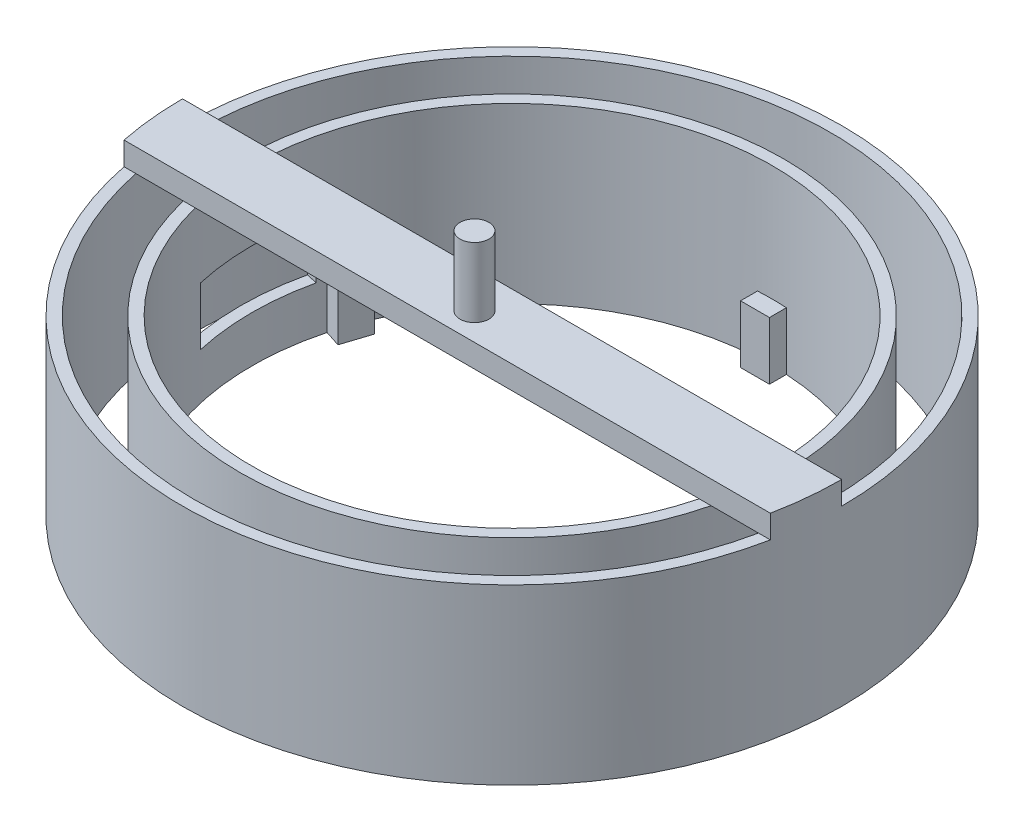
from build123d import *

# Parameters (mm, degrees)
SKETCH1_R             = 23.5
SKETCH1_R_2           = 22.5
BOSS_EXTRUDE1_DEPTH   = 15
SKETCH1_R_3           = 28.5
SKETCH1_R_4           = 27.5
BOSS_EXTRUDE1_2_DEPTH = 15
CUT_EXTRUDE2_DEPTH    = 5
BOSS_EXTRUDE3_DEPTH   = 2
SKETCH5_R             = 1.25
BOSS_EXTRUDE4_DEPTH   = 6
CUT_EXTRUDE3_START    = -2
CUT_EXTRUDE3_DEPTH    = 2
SKETCH7_W             = 2.5
SKETCH7_H             = 1.5
BOSS_EXTRUDE5_DEPTH   = 5
CIRPATTERN1_COUNT     = 5


with BuildPart() as part:
    # Sketch1 → Boss-Extrude1 (new body)
    with BuildSketch(Plane(origin=(0, 0, 0), x_dir=(1, 0, 0), z_dir=(0, 1, 0))):
        Circle(SKETCH1_R)
        Circle(SKETCH1_R_2, mode=Mode.SUBTRACT)
    extrude(amount=BOSS_EXTRUDE1_DEPTH)

    # Sketch4 → Cut-Extrude2 (cut)
    with BuildSketch(Plane(origin=(0, 4, 0), x_dir=(-1, 0, 0), z_dir=(0, -1, 0))):
        with BuildLine():
            Line((22.912407012, 5.222222222), (21.937410968, 5))
            ThreePointArc((21.937410968, 5), (22.5, 0), (21.937410968, -5))
            Line((21.937410968, -5), (22.912407012, -5.222222222))
            ThreePointArc((22.912407012, -5.222222222), (23.5, 0), (22.912407012, 5.222222222))
        make_face()
        with BuildLine():
            Line((-22.912407012, -5.222222222), (-21.937410968, -5))
            ThreePointArc((-21.937410968, -5), (-22.5, 0), (-21.937410968, 5))
            Line((-21.937410968, 5), (-22.912407012, 5.222222222))
            ThreePointArc((-22.912407012, 5.222222222), (-23.5, 0), (-22.912407012, -5.222222222))
        make_face()
        with BuildLine():
            Line((-5.222222222, -22.912407012), (-5, -21.937410968))
            ThreePointArc((-5, -21.937410968), (0, -22.5), (5, -21.937410968))
            Line((5, -21.937410968), (5.222222222, -22.912407012))
            ThreePointArc((5.222222222, -22.912407012), (0, -23.5), (-5.222222222, -22.912407012))
        make_face()
    extrude(amount=-CUT_EXTRUDE2_DEPTH, mode=Mode.SUBTRACT)



with BuildPart() as body_2:
    # Sketch1 → Boss-Extrude1 2 (new body)
    with BuildSketch(Plane(origin=(0, 0, 0), x_dir=(1, 0, 0), z_dir=(0, 1, 0))):
        Circle(SKETCH1_R_3)
        Circle(SKETCH1_R_4, mode=Mode.SUBTRACT)
    extrude(amount=BOSS_EXTRUDE1_2_DEPTH)


with BuildPart() as part_1:
    add(part.part)

    add(body_2.part)  # Boss-Extrude3 merges body 2
    # Sketch3 → Boss-Extrude3 (add)
    with BuildSketch(Plane(origin=(0, 15, 0), x_dir=(1, 0, 0), z_dir=(0, 1, 0))):
        with BuildLine():
            Line((-28.5, 0), (28.5, 0))
            ThreePointArc((28.5, 0), (0, -28.5), (-28.5, 0))
        make_face()
    extrude(amount=BOSS_EXTRUDE3_DEPTH)

    # Sketch5 → Boss-Extrude4 (add)
    with BuildSketch(Plane(origin=(0, 17, 0), x_dir=(1, 0, 0), z_dir=(0, 1, 0))):
        with Locations((0, -3.253176926)):
            Circle(SKETCH5_R)
    extrude(amount=BOSS_EXTRUDE4_DEPTH)

    # Sketch6 → Cut-Extrude3 (cut)
    with BuildSketch(Plane(origin=(0, 17, 0), x_dir=(1, 0, 0), z_dir=(0, 1, 0)).offset(CUT_EXTRUDE3_START)):
        with BuildLine():
            Line((-27.941794444, -5.613031555), (27.941794444, -5.613031555))
            ThreePointArc((27.941794444, -5.613031555), (0, -28.5), (-27.941794444, -5.613031555))
        make_face()
    extrude(amount=CUT_EXTRUDE3_DEPTH, mode=Mode.SUBTRACT)

    # Sketch7 → Boss-Extrude5 (add)
    with BuildSketch(Plane.XZ):
        with Locations((0, -21.75)):
            Rectangle(SKETCH7_W, SKETCH7_H)
    boss_extrude5 = extrude(amount=-BOSS_EXTRUDE5_DEPTH)

    # CirPattern1: Boss-Extrude5 ×5 about axis
    cirpattern1_axis = Axis((0, 0, 0), (0, 1, 0))
    for i in range(1, CIRPATTERN1_COUNT):
        add(boss_extrude5.rotate(cirpattern1_axis, i * 360 / CIRPATTERN1_COUNT))


solid = part_1.part
